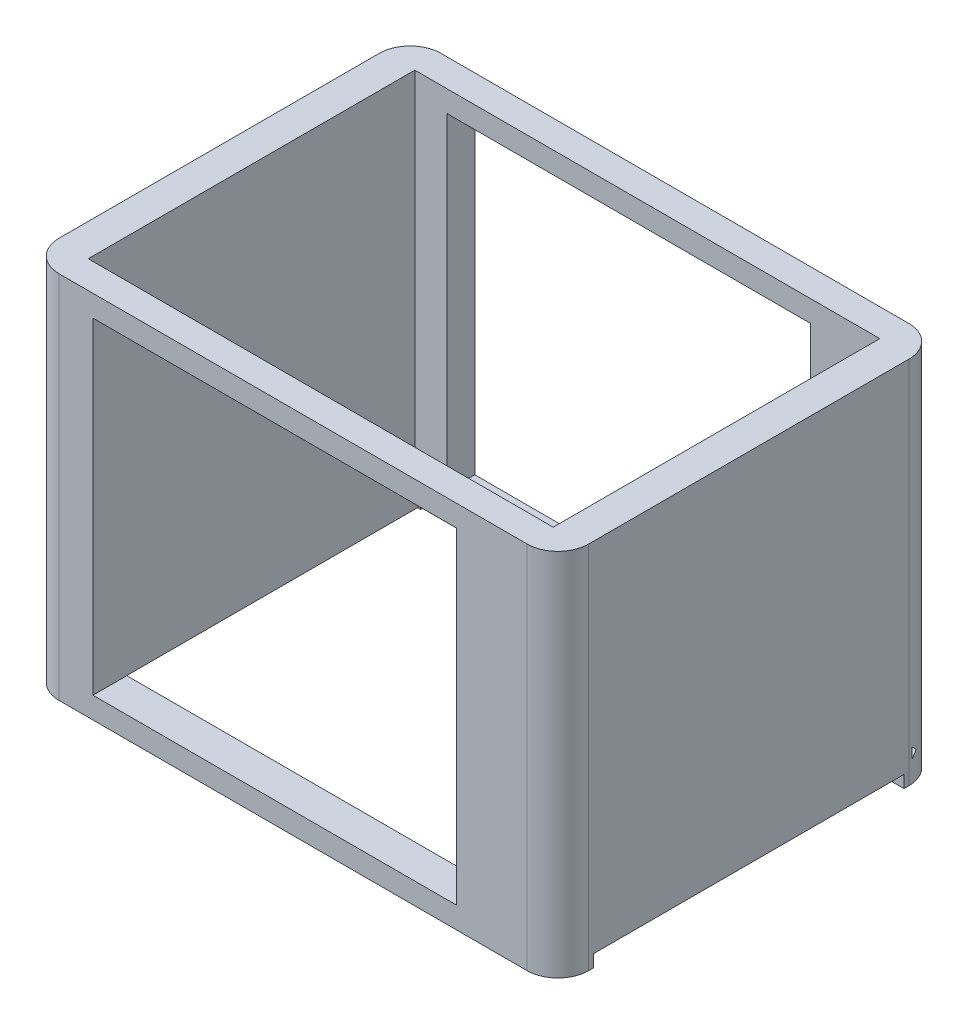
from build123d import *

# Parameters (mm, degrees)
SKETCH_1_W               = 86
SKETCH_1_H               = 62
SKETCH_1_W_2             = 71
SKETCH_1_H_2             = 51
EXTRUDE_1_DEPTH          = 60
SKETCH_2_W               = 75.5
SKETCH_2_H               = 53.03
CUT_EXTRUDE_1_DEPTH      = 56.5
EXTRUDE_2_DEPTH          = 76
SKETCH_4_W               = 59
SKETCH_4_H               = 53.03
CUT_EXTRUDE_2_DEPTH      = 97.400207469
CUT_EXTRUDE_3_DEPTH      = 97.908461963
CUT_EXTRUDE_3_DEPTH_BACK = 97.908461963
SKETCH_7_W               = 86
SKETCH_7_H               = 50.4
CUT_EXTRUDE_4_DEPTH      = 2
FILLET_1_R               = 5
FILLET_2_R               = 3


with BuildPart() as part:
    # 草图1 → 凸台-拉伸1 (new body)
    with BuildSketch(Plane(origin=(0, 0, 0), x_dir=(1, 0, 0), z_dir=(0, 1, 0))):
        Rectangle(SKETCH_1_W, SKETCH_1_H)
        Rectangle(SKETCH_1_W_2, SKETCH_1_H_2, mode=Mode.SUBTRACT)
    extrude(amount=EXTRUDE_1_DEPTH)

    # 草图2 → 切除-拉伸1 (cut)
    with BuildSketch(Plane(origin=(0, 60, 0), x_dir=(1, 0, 0), z_dir=(0, 1, 0))):
        Rectangle(SKETCH_2_W, SKETCH_2_H)
    extrude(amount=-CUT_EXTRUDE_1_DEPTH, mode=Mode.SUBTRACT)

    # 草图3 → 凸台-拉伸2 (add)
    with BuildSketch(Plane(origin=(-37.75, 0, 0), x_dir=(0, 0, -1), z_dir=(1, 0, 0))):
        Polygon((26.515, 3.5), (-26.515, 60), (-26.515, 3.5), align=None)
    extrude(amount=EXTRUDE_2_DEPTH)

    # 草图4 → 切除-拉伸2 (cut, through all)
    with BuildSketch(Plane.XY.offset(31)):
        with Locations((-3, 30)):
            Rectangle(SKETCH_4_W, SKETCH_4_H)
    extrude(amount=-CUT_EXTRUDE_2_DEPTH, mode=Mode.SUBTRACT)

    # 草图5 → 切除-拉伸3 (cut, two sides: drawn at the far end of the back side and taken through both)
    with BuildSketch(Plane.ZY.offset(-26.5).offset(-CUT_EXTRUDE_3_DEPTH_BACK)):
        Polygon((-26.515, 3.5), (-27.363528137, 4.348528137), (-26.515, 5.197056275), align=None)
    extrude(amount=CUT_EXTRUDE_3_DEPTH + CUT_EXTRUDE_3_DEPTH_BACK, mode=Mode.SUBTRACT)

    # 草图7 → 切除-拉伸4 (cut)
    with BuildSketch(Plane.XZ):
        Rectangle(SKETCH_7_W, SKETCH_7_H)
    extrude(amount=-CUT_EXTRUDE_4_DEPTH, mode=Mode.SUBTRACT)

    # 圆角1
    # the kernel refuses this fillet: 5 mm, written as the material it takes off along each edge
    with BuildSketch(Plane(origin=(43, -12.5, 31), x_dir=(-1, 0, 0), z_dir=(0, 1, 0)), Plane(origin=(43, -12.5, -31), x_dir=(0, 0, 1), z_dir=(0, 1, 0))) as fillet_1_piece_1:
        with BuildLine():
            CenterArc((FILLET_1_R, -FILLET_1_R), FILLET_1_R, 90, 90)
            Line((0, -FILLET_1_R), (0, 0))
            Line((0, 0), (FILLET_1_R, 0))
        make_face()
    extrude(amount=85, mode=Mode.SUBTRACT)
    with BuildSketch(Plane(origin=(-43, -12.5, 31), x_dir=(1, 0, 0), z_dir=(0, 1, 0)), Plane(origin=(-43, -12.5, -31), x_dir=(0, 0, 1), z_dir=(0, 1, 0))) as fillet_1_piece_2:
        with BuildLine():
            CenterArc((FILLET_1_R, FILLET_1_R), FILLET_1_R, 180, 90)
            Line((0, FILLET_1_R), (0, 0))
            Line((0, 0), (FILLET_1_R, 0))
        make_face()
    extrude(amount=85, mode=Mode.SUBTRACT)

    # 圆角2
    # the kernel refuses this fillet: 3 mm, written as the material it takes off along each edge
    with BuildSketch(Plane(origin=(37.75, 5.197056275, -26.515), x_dir=(0, 1, 0), z_dir=(-1, 0, 0))) as fillet_2_piece_1_section:
        with BuildLine():
            CenterArc((FILLET_2_R * 0.414213562373, FILLET_2_R), FILLET_2_R, 225, 45)
            Line((-FILLET_2_R * 0.292893218813, FILLET_2_R * 0.292893218813), (0, 0))
            Line((0, 0), (FILLET_2_R * 0.414213562373, 0))
        make_face()
    fillet_2_piece_1 = extrude(amount=14.356601718, mode=Mode.PRIVATE)
    fillet_2_piece_1 = split(fillet_2_piece_1, bisect_by=Plane(origin=(32.125, 4.476160676, -27.491160676), z_dir=(0, 0.7071067811865434, 0.7071067811865518)), keep=Keep.TOP, mode=Mode.PRIVATE)
    add(fillet_2_piece_1, mode=Mode.SUBTRACT)
    with BuildSketch(Plane(origin=(-29.393398282, 5.197056275, -26.515), x_dir=(0, 1, 0), z_dir=(-1, 0, 0))) as fillet_2_piece_2_section:
        with BuildLine():
            CenterArc((FILLET_2_R * 0.414213562373, FILLET_2_R), FILLET_2_R, 225, 45)
            Line((-FILLET_2_R * 0.292893218813, FILLET_2_R * 0.292893218813), (0, 0))
            Line((0, 0), (FILLET_2_R * 0.414213562373, 0))
        make_face()
    fillet_2_piece_2 = extrude(amount=8.356601718, mode=Mode.PRIVATE)
    fillet_2_piece_2 = split(fillet_2_piece_2, bisect_by=Plane(origin=(-35.125, 4.476160676, -27.491160676), z_dir=(0, 0.7071067811865434, 0.7071067811865518)), keep=Keep.TOP, mode=Mode.PRIVATE)
    add(fillet_2_piece_2, mode=Mode.SUBTRACT)


solid = part.part
